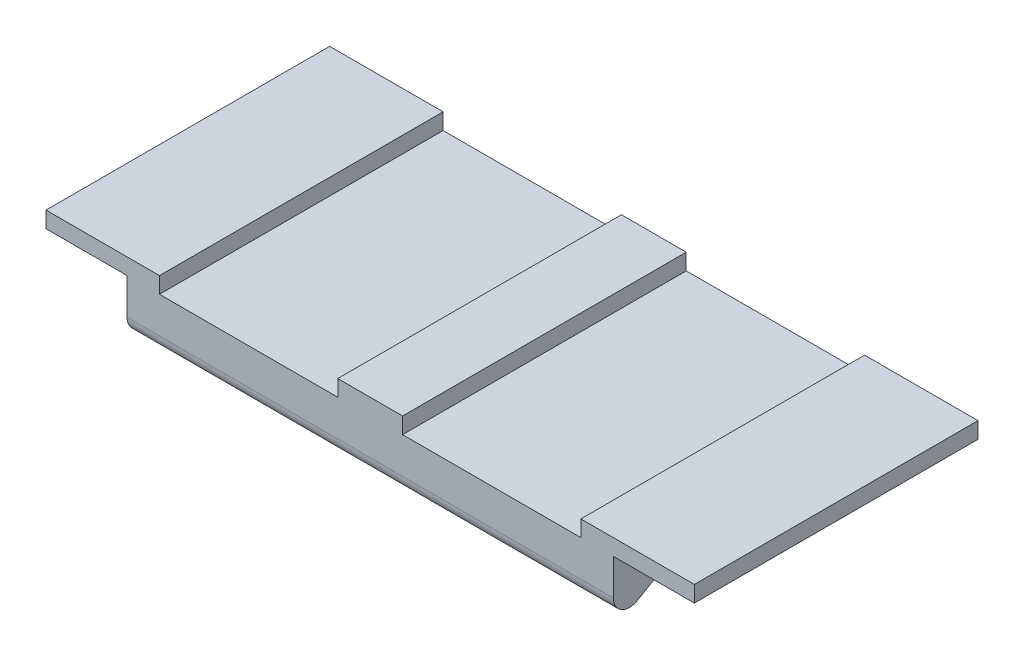
from build123d import *

# Parameters (mm, degrees)
SKETCH1_W               = 60
SKETCH1_H               = 35
BOSS_EXTRUDE1_DEPTH     = 10
CUT_EXTRUDE1_DEPTH      = 64.294944506
CUT_EXTRUDE1_DEPTH_BACK = 64.294944506
FILLET1_R               = 2
SKETCH3_W               = 22
SKETCH3_H               = 2
CUT_EXTRUDE2_DEPTH      = 47.868972419
SKETCH5_W               = 35
SKETCH5_H               = 2
BOSS_EXTRUDE2_DEPTH     = 10


with BuildPart() as part:
    # Sketch1 → Boss-Extrude1 (new body)
    with BuildSketch(Plane(origin=(0, 0, 0), x_dir=(1, 0, 0), z_dir=(0, 1, 0))):
        Rectangle(SKETCH1_W, SKETCH1_H)
    extrude(amount=-BOSS_EXTRUDE1_DEPTH)

    # Sketch2 → Cut-Extrude1 (cut, two sides: drawn at the far end of the back side and taken through both)
    with BuildSketch(Plane(origin=(30, 0, 0), x_dir=(0, 0, -1), z_dir=(1, 0, 0)).offset(-CUT_EXTRUDE1_DEPTH_BACK)):
        Polygon((-12.5, -7), (-17.5, -10), (17.5, -10), (12.5, -7), align=None)
    extrude(amount=CUT_EXTRUDE1_DEPTH + CUT_EXTRUDE1_DEPTH_BACK, mode=Mode.SUBTRACT)

    # Fillet1
    fillet1_edges = [part.edges().sort_by_distance(p)[0] for p in [
        (0, -7, 12.5),
        (0, -7, -12.5),
        (0, -10, -17.5),
        (0, -10, 17.5),
    ]]
    fillet(fillet1_edges, radius=FILLET1_R)

    # Sketch3 → Cut-Extrude2 (cut, through all)
    with BuildSketch(Plane.XY.offset(17.5)):
        with Locations((-15, -1)):
            Rectangle(SKETCH3_W, SKETCH3_H)
        with Locations((15, -1)):
            Rectangle(SKETCH3_W, SKETCH3_H)
    extrude(amount=-CUT_EXTRUDE2_DEPTH, mode=Mode.SUBTRACT)

    # Sketch5 → Boss-Extrude2 (add)
    with BuildSketch(Plane.ZY.offset(30)):
        with Locations((0, -1)):
            Rectangle(SKETCH5_W, SKETCH5_H)
    boss_extrude2 = extrude(amount=BOSS_EXTRUDE2_DEPTH)

    # Mirror1: Boss-Extrude2 across plane
    add(boss_extrude2.mirror(Plane(origin=(0, 0, 0), x_dir=(0, 0, 1), z_dir=(1, 0, 0))))


solid = part.part
